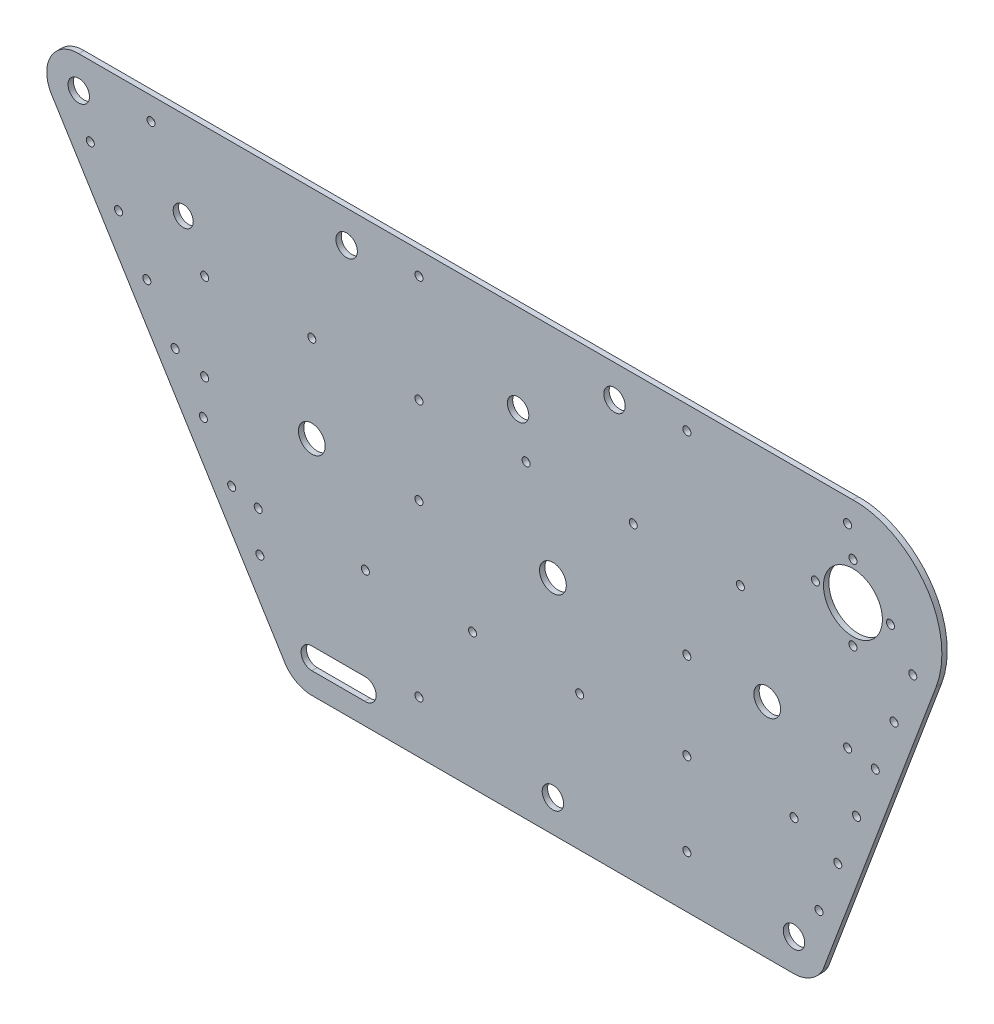
from build123d import *

# Parameters (mm, degrees)
BOSS_EXTRUDE1_DEPTH = 2
SKETCH4_R           = 3.9998
SKETCH4_R_2         = 1.499925
SKETCH4_R_3         = 3.7498125
SKETCH4_R_4         = 10.99945
SKETCH4_R_5         = 4.99975
SKETCH4_R_6         = 3.999800521
CUT_EXTRUDE1_DEPTH  = 2


with BuildPart() as part:
    # Sketch3 → Boss-Extrude1 (new body)
    with BuildSketch(Plane.XY):
        with BuildLine():
            Line((-106.00519968, 144.943614194), (182.96308424, 145.197672799))
            add(Edge.make_bspline(
                [(214.06903129, 100.332253713), (217.202846332, 108.581551057), (216.384279944, 131.51380425), (195.382789786, 145.608716116), (182.96308424, 145.197672799)],
                knots=[0, 0, 0, 0, 0.416238876, 1, 1, 1, 1], degree=3))
            Line((214.06903129, 100.332253713), (171.900116679, -12))
            add(Edge.make_bspline(
                [(160.991950179, -19), (165.457889658, -19.068752161), (170.106996065, -16.09051608), (171.900116679, -12)],
                knots=[0, 0, 0, 0, 1, 1, 1, 1], degree=3))
            Line((160.991950179, -19), (-18.999049973, -19))
            add(Edge.make_bspline(
                [(-18.999049973, -19), (-23.419302443, -19.069581379), (-27.756029743, -16.362926839), (-29.701931061, -12.425576557)],
                knots=[0, 0, 0, 0, 1, 1, 1, 1], degree=3))
            Line((-29.701931061, -12.425576557), (-116.08546313, 126.611232779))
            add(Edge.make_bspline(
                [(-106.00519968, 144.943614194), (-112.924010598, 145.092654371), (-119.661868892, 137.031763828), (-117.348474018, 128.592298794), (-116.08546313, 126.611232779)],
                knots=[0, 0, 0, 0, 0.715346285, 1, 1, 1, 1], degree=3))
        make_face()
    extrude(amount=BOSS_EXTRUDE1_DEPTH)

    # Sketch4 → Cut-Extrude1 (cut)
    with BuildSketch(Plane.XY.offset(2)):
        with Locations((-105.9947, 133)):
            Circle(SKETCH4_R)
        with Locations((-78.996040132, 136.5)):
            Circle(SKETCH4_R_2)
        with Locations((-101.689209002, 118.598380963)):
            Circle(SKETCH4_R_2)
        with Locations((-91.134705429, 101.610600241)):
            Circle(SKETCH4_R_2)
        with Locations((-66.99665, 112)):
            Circle(SKETCH4_R_3)
        with Locations((-80.580283096, 84.622950275)):
            Circle(SKETCH4_R_2)
        with Locations((-5.9997, 133)):
            Circle(SKETCH4_R)
        with Locations((20.99895, 136.5)):
            Circle(SKETCH4_R_2)
        with Locations((20.99895, 96.5)):
            Circle(SKETCH4_R_2)
        with Locations((-18.99905, 96.5)):
            Circle(SKETCH4_R_2)
        with Locations((-58.99705, 96.5)):
            Circle(SKETCH4_R_2)
        with Locations((57.9971, 112)):
            Circle(SKETCH4_R)
        with Locations((60.99695, 96.5)):
            Circle(SKETCH4_R_2)
        with Locations((182.99085, 112)):
            Circle(SKETCH4_R_4)
        with Locations((182.99085, 126)):
            Circle(SKETCH4_R_2)
        with Locations((180.99095, 136.5)):
            Circle(SKETCH4_R_2)
        with Locations((120.99395, 136.5)):
            Circle(SKETCH4_R_2)
        with Locations((93.995220809, 133)):
            Circle(SKETCH4_R)
        with Locations((100.99495, 96.5)):
            Circle(SKETCH4_R_2)
        with Locations((140.99295, 96.5)):
            Circle(SKETCH4_R_2)
        with Locations((168.99155, 112)):
            Circle(SKETCH4_R_2)
        with Locations((196.99015, 112)):
            Circle(SKETCH4_R_2)
        with Locations((182.99085, 98)):
            Circle(SKETCH4_R_2)
        with Locations((205.322481122, 99.795751553)):
            Circle(SKETCH4_R_2)
        with Locations((198.324441471, 81.060193672)):
            Circle(SKETCH4_R_2)
        with Locations((150.99245, 64)):
            Circle(SKETCH4_R_5)
        with Locations((180.99095, 64)):
            Circle(SKETCH4_R_2)
        with Locations((191.32646769, 62.324812144)):
            Circle(SKETCH4_R_2)
        with Locations((120.99395, 64)):
            Circle(SKETCH4_R_2)
        with Locations((184.328557385, 43.589600555)):
            Circle(SKETCH4_R_2)
        with Locations((70.99645, 64)):
            Circle(SKETCH4_R_5)
        with Locations((20.99895, 64)):
            Circle(SKETCH4_R_2)
        with Locations((0.99995, 31.499992415)):
            Circle(SKETCH4_R_2)
        with Locations((40.99795, 31.499988622)):
            Circle(SKETCH4_R_2)
        with Locations((80.99595, 31.499985778)):
            Circle(SKETCH4_R_2)
        with Locations((120.99395, 31.499981037)):
            Circle(SKETCH4_R_2)
        with Locations((160.99195, 31.499978192)):
            Circle(SKETCH4_R_2)
        with Locations((177.330672341, 24.854456596)):
            Circle(SKETCH4_R_2)
        with Locations((-18.99905, 64)):
            Circle(SKETCH4_R_5)
        with Locations((-70.02547384, 67.634677545)):
            Circle(SKETCH4_R_2)
        with Locations((-58.99705, 64)):
            Circle(SKETCH4_R_2)
        with Locations((-59.470762984, 50.646563195)):
            Circle(SKETCH4_R_2)
        with Locations((-48.916261932, 33.658786529)):
            Circle(SKETCH4_R_2)
        with Locations((-38.99805, 31.499994311)):
            Circle(SKETCH4_R_2)
        with Locations((-38.361920415, 16.671266638)):
            Circle(SKETCH4_R_2)
        with Locations((20.99895, 0.5)):
            Circle(SKETCH4_R_2)
        with Locations((70.99645, -7)):
            Circle(SKETCH4_R_6)
        with Locations((160.99195, -7)):
            Circle(SKETCH4_R)
        with Locations((170.332531489, 6.118627774)):
            Circle(SKETCH4_R_2)
        with Locations((120.99395, 0.5)):
            Circle(SKETCH4_R_2)
        with BuildLine():
            Line((-18.99905, -3), (0.99995, -3))
            ThreePointArc((0.99995, -3), (4.997676605, -7.132915612), (0.742271816, -11))
            Line((0.742271816, -11), (-18.99905, -11))
            ThreePointArc((-18.99905, -11), (-22.99885, -7), (-18.99905, -3))
        make_face()
    extrude(amount=-CUT_EXTRUDE1_DEPTH, mode=Mode.SUBTRACT)


solid = part.part
